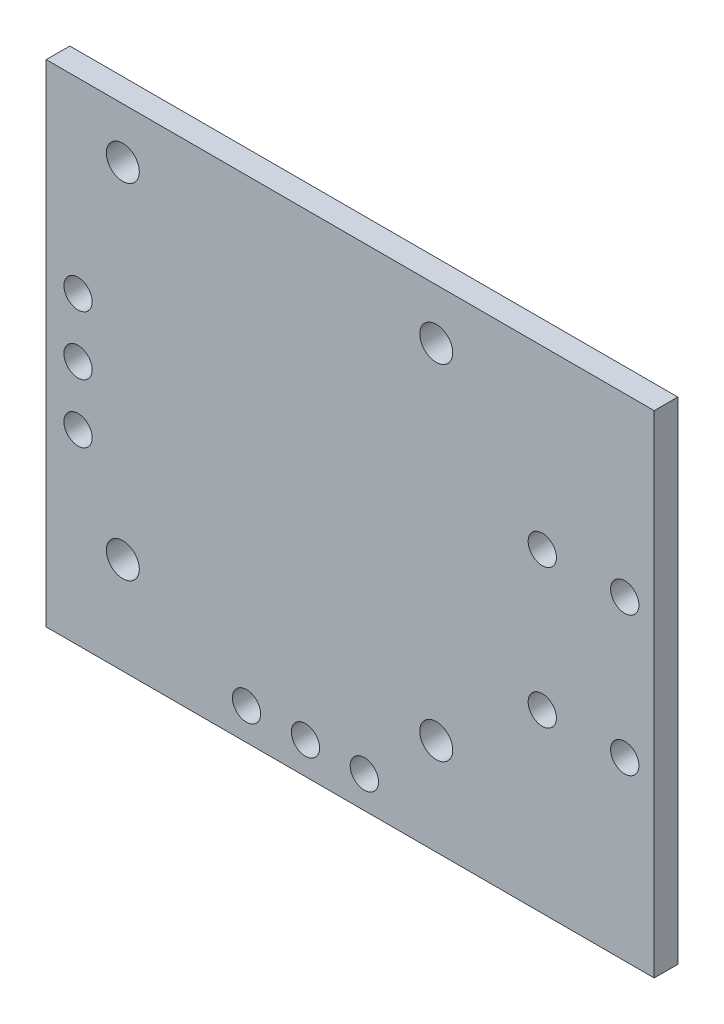
from build123d import *

# Parameters (mm, degrees)
SKETCH_1_W      = 25.8
SKETCH_1_H      = 20.85
SKETCH_1_R      = 0.7
SKETCH_1_R_2    = 0.6
EXTRUDE_1_DEPTH = 1


with BuildPart() as part:
    # ｽｹｯﾁ1 → ﾎﾞｽ - 押し出し1 (new body)
    with BuildSketch(Plane.XY):
        with Locations((12.9, -10.425)):
            Rectangle(SKETCH_1_W, SKETCH_1_H)
        with Locations((3.25, -16.75)):
            Circle(SKETCH_1_R, mode=Mode.SUBTRACT)
        with Locations((8.5, -19.5)):
            Circle(SKETCH_1_R_2, mode=Mode.SUBTRACT)
        with Locations((11, -19.5)):
            Circle(SKETCH_1_R_2, mode=Mode.SUBTRACT)
        with Locations((1.35, -12.925)):
            Circle(SKETCH_1_R_2, mode=Mode.SUBTRACT)
        with Locations((13.5, -19.5)):
            Circle(SKETCH_1_R_2, mode=Mode.SUBTRACT)
        with Locations((16.55, -16.75)):
            Circle(SKETCH_1_R, mode=Mode.SUBTRACT)
        with Locations((21.05, -13.375)):
            Circle(SKETCH_1_R_2, mode=Mode.SUBTRACT)
        with Locations((24.55, -13.375)):
            Circle(SKETCH_1_R_2, mode=Mode.SUBTRACT)
        with Locations((1.35, -10.425)):
            Circle(SKETCH_1_R_2, mode=Mode.SUBTRACT)
        with Locations((1.35, -7.925)):
            Circle(SKETCH_1_R_2, mode=Mode.SUBTRACT)
        with Locations((3.25, -2.15)):
            Circle(SKETCH_1_R, mode=Mode.SUBTRACT)
        with Locations((21.05, -7.475)):
            Circle(SKETCH_1_R_2, mode=Mode.SUBTRACT)
        with Locations((24.55, -7.475)):
            Circle(SKETCH_1_R_2, mode=Mode.SUBTRACT)
        with Locations((16.55, -2.15)):
            Circle(SKETCH_1_R, mode=Mode.SUBTRACT)
    extrude(amount=EXTRUDE_1_DEPTH)


solid = part.part
